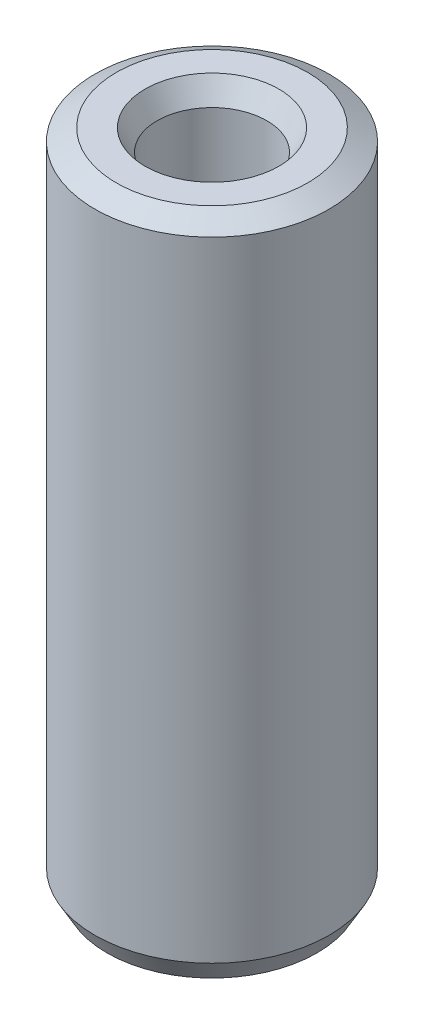
from build123d import *
from OCP.BRepFilletAPI import BRepFilletAPI_MakeChamfer

# Parameters (mm, degrees)
SKETCH1_R           = 37.5
BOSS_EXTRUDE1_DEPTH = 212.099046316
SKETCH2_R           = 17.566500284
CUT_EXTRUDE1_DEPTH  = 219.628693104
CHAMFER1_SIZE       = 3.868140717
CHAMFER1_SIZE2      = 6.841367971


with BuildPart() as part:
    # Sketch1 → Boss-Extrude1 (new body)
    with BuildSketch(Plane(origin=(0, 0, 0), x_dir=(1, 0, 0), z_dir=(0, 1, 0))):
        Circle(SKETCH1_R)
    extrude(amount=BOSS_EXTRUDE1_DEPTH)

    # Sketch2 → Cut-Extrude1 (cut, through all)
    with BuildSketch(Plane(origin=(0, 0, 0), x_dir=(1, 0, 0), z_dir=(0, 1, 0))):
        Circle(SKETCH2_R)
    extrude(amount=CUT_EXTRUDE1_DEPTH, mode=Mode.SUBTRACT)

    # Chamfer1: one chamfer whose edges measure the first distance from different faces: ONE call of the kernel's chamfer builder (chamfer() names one face for all edges)
    chamfer1_edges_1 = [part.edges().sort_by_distance(p)[0] for p in [
        (-17.566500284, 212.099046316, 0),
    ]]
    chamfer1_side_1 = [part.faces().sort_by_distance(p)[0] for p in [
        (-36.439339828, 212.099046316, 0),
    ]]
    chamfer1_edges_2 = [part.edges().sort_by_distance(p)[0] for p in [
        (-17.566500284, 0, 0),
    ]]
    chamfer1_side_2 = [part.faces().sort_by_distance(p)[0] for p in [
        (-17.566500284, 106.049523158, 0),
    ]]
    chamfer1_edges_3 = [part.edges().sort_by_distance(p)[0] for p in [
        (-37.5, 0, 0),
    ]]
    chamfer1_side_3 = [part.faces().sort_by_distance(p)[0] for p in [
        (-36.439339828, 0, 0),
    ]]
    chamfer1_edges_4 = [part.edges().sort_by_distance(p)[0] for p in [
        (-37.5, 212.099046316, 0),
    ]]
    chamfer1_side_4 = [part.faces().sort_by_distance(p)[0] for p in [
        (-37.5, 106.049523158, 0),
    ]]
    chamfer1 = BRepFilletAPI_MakeChamfer(part.part.solid().wrapped)
    for e in chamfer1_edges_1:
        chamfer1.Add(CHAMFER1_SIZE, CHAMFER1_SIZE2, e.wrapped, chamfer1_side_1[0].wrapped)  # the first distance lies on this face
    for e in chamfer1_edges_2:
        chamfer1.Add(CHAMFER1_SIZE, CHAMFER1_SIZE2, e.wrapped, chamfer1_side_2[0].wrapped)  # the first distance lies on this face
    for e in chamfer1_edges_3:
        chamfer1.Add(CHAMFER1_SIZE, CHAMFER1_SIZE2, e.wrapped, chamfer1_side_3[0].wrapped)  # the first distance lies on this face
    for e in chamfer1_edges_4:
        chamfer1.Add(CHAMFER1_SIZE, CHAMFER1_SIZE2, e.wrapped, chamfer1_side_4[0].wrapped)  # the first distance lies on this face
    add(Compound.cast(chamfer1.Shape()), mode=Mode.REPLACE)


solid = part.part
